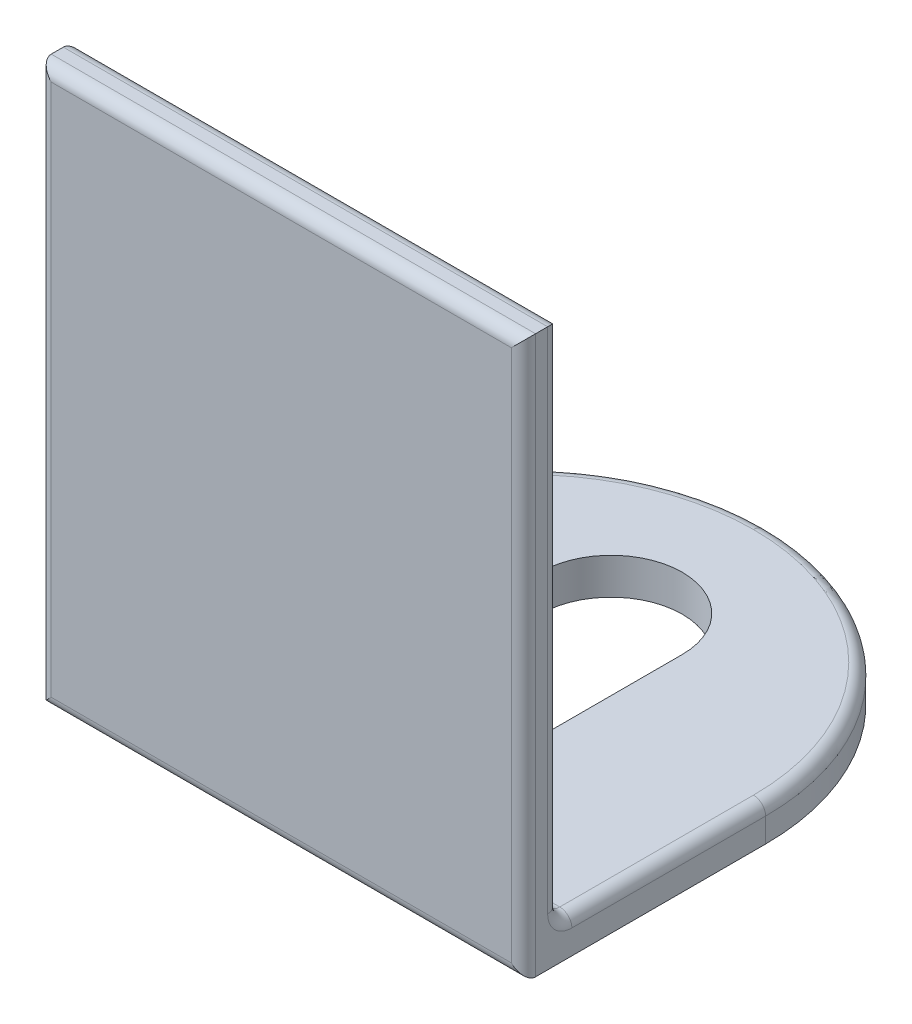
from build123d import *

# Parameters (mm, degrees)
SKETCH2_W           = 40
SKETCH2_H           = 40
BOSS_EXTRUDE1_DEPTH = 3
SKETCH4_W           = 40
SKETCH4_H           = 3
BOSS_EXTRUDE2_DEPTH = 43
FILLET3_R           = 20
CUT_EXTRUDE1_DEPTH  = 37
FILLET4_R           = 1


with BuildPart() as part:
    # Sketch2 → Boss-Extrude1 (new body)
    with BuildSketch(Plane(origin=(0, 0, 0), x_dir=(1, 0, 0), z_dir=(0, 1, 0))):
        Rectangle(SKETCH2_W, SKETCH2_H)
    extrude(amount=BOSS_EXTRUDE1_DEPTH)

    # Sketch4 → Boss-Extrude2 (add)
    with BuildSketch(Plane(origin=(0, 3, 0), x_dir=(1, 0, 0), z_dir=(0, 1, 0))):
        with Locations((0, -18.5)):
            Rectangle(SKETCH4_W, SKETCH4_H)
    extrude(amount=BOSS_EXTRUDE2_DEPTH)

    # Fillet3
    fillet3_edges = [part.edges().sort_by_distance(p)[0] for p in [
        (20, 1.5, -20),
        (-20, 1.5, -20),
    ]]
    fillet(fillet3_edges, radius=FILLET3_R - 0.0001)  # a hair under: the kernel refuses the full size

    # Sketch5 → Cut-Extrude1 (cut)
    with BuildSketch(Plane.XZ):
        with BuildLine():
            Line((6, -7.120873555), (6, 5.305936672))
            ThreePointArc((6, 5.305936672), (1.096488494, 12.934754262), (-5.757118415, 6.995785055))
            Line((-5.757118415, 6.995785055), (-5.757118415, -7.120873555))
            ThreePointArc((-5.757118415, -7.120873555), (0.121440793, -12.999432762), (6, -7.120873555))
        make_face()
    extrude(amount=-CUT_EXTRUDE1_DEPTH, mode=Mode.SUBTRACT)

    # Fillet4
    fillet4_edges = [part.edges().sort_by_distance(p)[0] for p in [
        (20, 3, 8.49995),
        (-20, 24.5, 17),
        (0, 3, 17),
        (20, 24.5, 17),
        (0, 46, 20),
        (0, 46, 17),
        (-20, 3, 8.49995),
        (-14.142164913, 3, -14.142164913),
        (14.142164913, 3, -14.142164913),
        (0, 0, 20),
        (20, 23, 20),
        (-20, 23, 20),
    ]]
    fillet(fillet4_edges, radius=FILLET4_R)


solid = part.part
